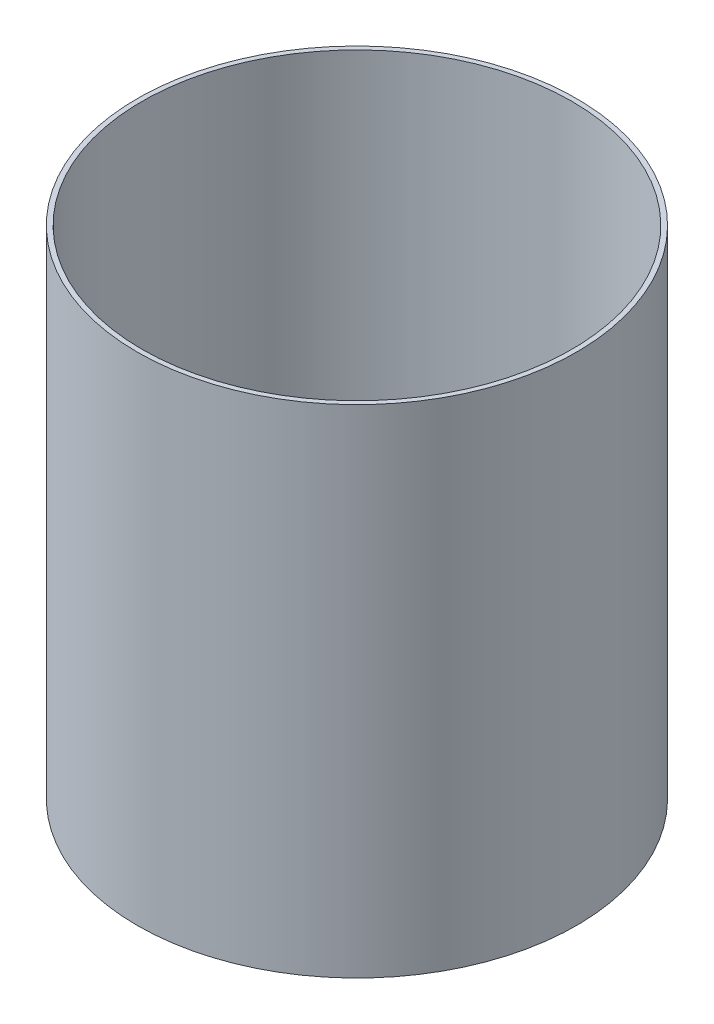
from build123d import *

# Parameters (mm, degrees)
SKETCH1_R               = 690
BOSS_EXTRUDE1_DEPTH     = 780
CUT_EXTRUDE1_DEPTH      = 1250.239768819
CUT_EXTRUDE1_DEPTH_BACK = 1250.239768819
SKETCH2_R               = 675


with BuildPart() as part:
    # Sketch1 → Boss-Extrude1 (new, symmetric)
    with BuildSketch(Plane(origin=(0, 0, 0), x_dir=(1, 0, 0), z_dir=(0, 1, 0))):
        Circle(SKETCH1_R)
    extrude(amount=BOSS_EXTRUDE1_DEPTH, both=True)

    # Sketch2 → Cut-Extrude1 (cut, two sides: drawn at the far end of the back side and taken through both)
    with BuildSketch(Plane(origin=(0, 0, 0), x_dir=(1, 0, 0), z_dir=(0, 1, 0)).offset(-CUT_EXTRUDE1_DEPTH_BACK)):
        Circle(SKETCH2_R)
    extrude(amount=CUT_EXTRUDE1_DEPTH + CUT_EXTRUDE1_DEPTH_BACK, mode=Mode.SUBTRACT)


solid = part.part
